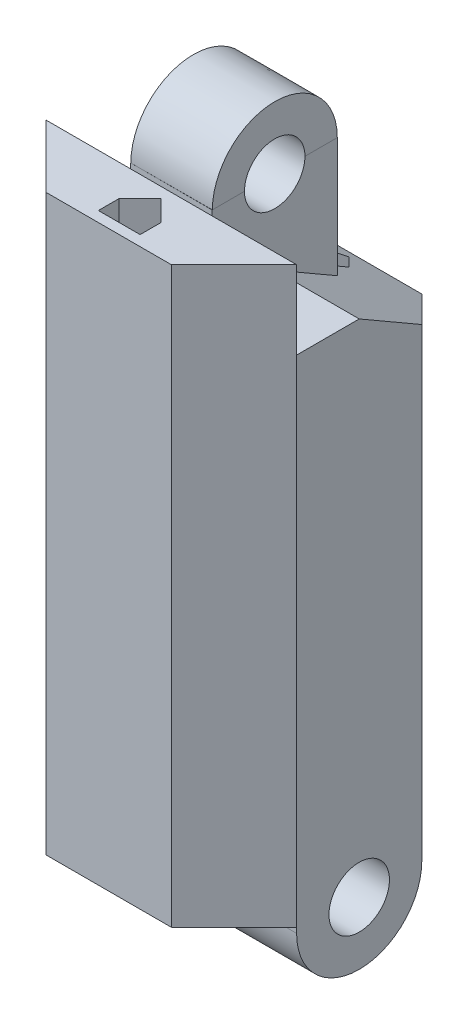
from build123d import *

# Parameters (mm, degrees)
BOSS_EXTRUDE1_DEPTH     = 10
CUT_EXTRUDE2_DEPTH      = 14.114877049
SKETCH6_W               = 3.9
SKETCH6_H               = 6
BOSS_EXTRUDE3_DEPTH     = 4
SKETCH7_W               = 3.9
SKETCH7_H               = 3
REVOLVE1_ANGLE          = 180
SKETCH9_R               = 1.45
CUT_EXTRUDE3_DEPTH      = 5
SKETCH10_W              = 3.9
SKETCH10_H              = 6
BOSS_EXTRUDE4_DEPTH     = 4
REVOLVE2_ANGLE          = 180
SKETCH14_R              = 1.45
CUT_EXTRUDE4_DEPTH      = 5
BOSS_EXTRUDE7_DEPTH     = 3.75
BOSS_EXTRUDE17_DEPTH    = 3.75
CUT_EXTRUDE6_DEPTH      = 20
CUT_EXTRUDE6_DEPTH_BACK = 20


with BuildPart() as part:
    # Sketch2 → Boss-Extrude1 (new, symmetric)
    with BuildSketch(Plane(origin=(0, 0, 0), x_dir=(1, 0, 0), z_dir=(0, 1, 0))):
        Polygon((-3, 6), (3, 6), (6, 3), (6, -3), (3, -6), (-3, -6), (-6, -3), (-6, 3), align=None)
    extrude(amount=BOSS_EXTRUDE1_DEPTH, both=True)

    # Sketch5 → Cut-Extrude2 (cut, symmetric)
    with BuildSketch(Plane(origin=(0, 0, 0), x_dir=(0, 0, -1), z_dir=(1, 0, 0))):
        Polygon((0, 10), (6, 6.535898385), (6, 10), align=None)
    cut_extrude2 = extrude(amount=CUT_EXTRUDE2_DEPTH, both=True, mode=Mode.SUBTRACT)

    # Mirror3: Cut-Extrude2 across plane
    add(cut_extrude2.mirror(Plane.ZX), mode=Mode.SUBTRACT)

    # Sketch6 → Boss-Extrude3 (add, symmetric)
    with BuildSketch(Plane.XZ.offset(10)):
        with Locations((-4.05, 0)):
            Rectangle(SKETCH6_W, SKETCH6_H)
    boss_extrude3 = extrude(amount=BOSS_EXTRUDE3_DEPTH, both=True)

    # Sketch7 → Revolve1 (revolve)
    with BuildSketch(Plane.XZ.offset(14)):
        with Locations((-4.05, 1.5)):
            Rectangle(SKETCH7_W, SKETCH7_H)
    revolve1 = revolve(axis=Axis((-6, -14, 0), (1, 0, 0)), revolution_arc=REVOLVE1_ANGLE)

    # Sketch9 → Cut-Extrude3 (cut, symmetric)
    with BuildSketch(Plane.ZY.offset(6)):
        with Locations((0, -14)):
            Circle(SKETCH9_R)
    cut_extrude3 = extrude(amount=CUT_EXTRUDE3_DEPTH, both=True, mode=Mode.SUBTRACT)

    # Mirror5: Boss-Extrude3, Revolve1, Cut-Extrude3 across plane
    add(boss_extrude3.mirror(Plane(origin=(0, 0, 0), x_dir=(0, 0, 1), z_dir=(1, 0, 0))))
    add(revolve1.mirror(Plane(origin=(0, 0, 0), x_dir=(0, 0, 1), z_dir=(1, 0, 0))))
    add(cut_extrude3.mirror(Plane(origin=(0, 0, 0), x_dir=(0, 0, 1), z_dir=(1, 0, 0))), mode=Mode.SUBTRACT)

    # Sketch10 → Boss-Extrude4 (add, symmetric)
    with BuildSketch(Plane(origin=(0, 10, 0), x_dir=(1, 0, 0), z_dir=(0, 1, 0))):
        Rectangle(SKETCH10_W, SKETCH10_H)
    extrude(amount=BOSS_EXTRUDE4_DEPTH, both=True)

    # Sketch12 → Revolve2 (revolve)
    with BuildSketch(Plane(origin=(0, 14, 0), x_dir=(1, 0, 0), z_dir=(0, 1, 0))):
        Polygon((-1.95, 3), (-1.95, 0), (1.95, 0.003655936), (1.95, 3), align=None)
    revolve(axis=Axis((-1.95, 14, 0), (0.9999995606226393, 0, -0.0009374190783233235)), revolution_arc=REVOLVE2_ANGLE)

    # Sketch14 → Cut-Extrude4 (cut, symmetric)
    with BuildSketch(Plane.ZY.offset(1.95)):
        with Locations((0, 14)):
            Circle(SKETCH14_R)
    extrude(amount=CUT_EXTRUDE4_DEPTH, both=True, mode=Mode.SUBTRACT)

    # Sketch17 → Boss-Extrude7 (add)
    with BuildSketch(Plane(origin=(0, 10, 0), x_dir=(1, 0, 0), z_dir=(0, 1, 0))):
        Polygon((-6, -3), (-1.95, -3), (1.95, -3), (6, -3), (3, -6), (-3, -6), align=None)
    extrude(amount=BOSS_EXTRUDE7_DEPTH)

    # Sketch19 → Boss-Extrude17 (add)
    with BuildSketch(Plane.XZ.offset(10)):
        Polygon((-6, 3), (-2.1, 3), (2.1, 3), (6, 3), (3, 6), (-3, 6), align=None)
    extrude(amount=BOSS_EXTRUDE17_DEPTH)

    # Sketch15 → Cut-Extrude6 (cut, two sides: drawn at the far end of the back side and taken through both)
    with BuildSketch(Plane(origin=(0, 0, 0), x_dir=(1, 0, 0), z_dir=(0, 1, 0)).offset(-CUT_EXTRUDE6_DEPTH_BACK)):
        Polygon((0, 5.5), (-1, 4.5), (-1, 3.5), (1, 3.5), (1, 4.5), align=None)
        Polygon((1, -4.5), (0, -3.5), (-1, -4.5), (-1, -5.5), (1, -5.5), align=None)
    extrude(amount=CUT_EXTRUDE6_DEPTH + CUT_EXTRUDE6_DEPTH_BACK, mode=Mode.SUBTRACT)


solid = part.part
